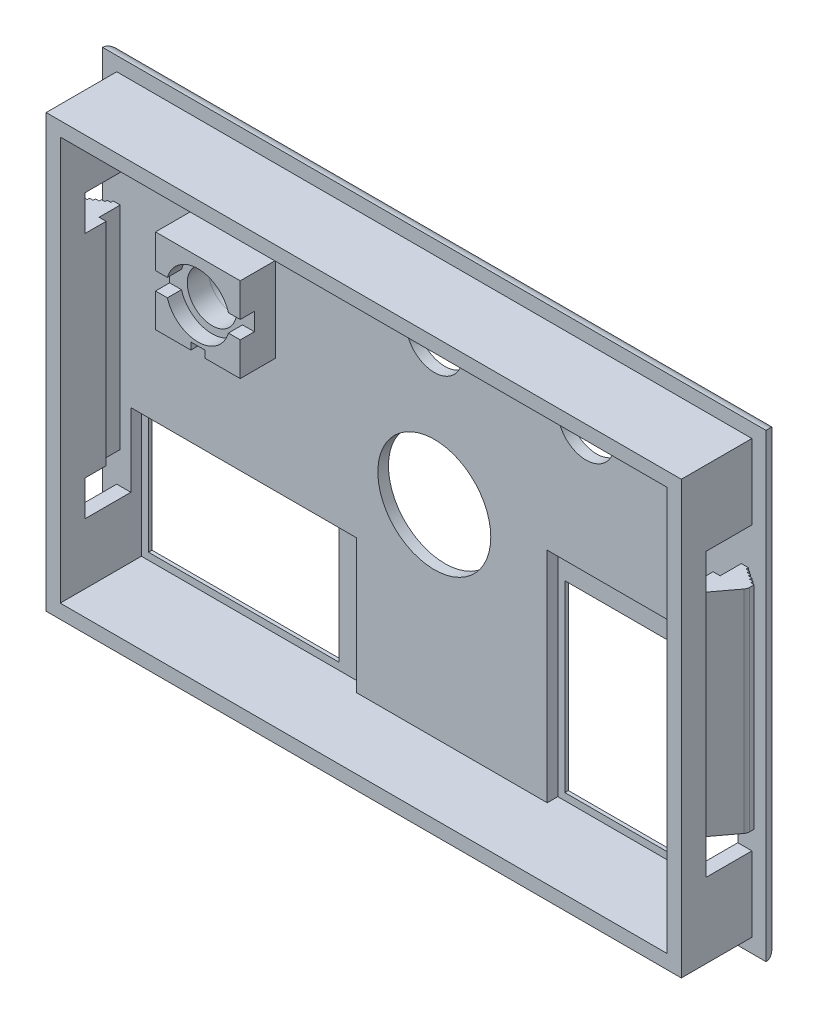
from build123d import *

# Parameters (mm, degrees)
SKETCH_1_W             = 94
SKETCH_1_H             = 65.2
EXTRUDE_1_DEPTH        = 2
SKETCH_2_R             = 8
SKETCH_2_R_2           = 3.5
SKETCH_2_R_3           = 4
SKETCH_2_W             = 27
SKETCH_2_H             = 17
SKETCH_2_W_2           = 25
SKETCH_2_H_2           = 26
CUT_EXTRUDE_1_DEPTH    = 2
SKETCH_3_W             = 90
SKETCH_3_H             = 61.2
SKETCH_3_W_2           = 86
SKETCH_3_H_2           = 57.2
EXTRUDE_2_DEPTH        = 10
SKETCH_4_R             = 9
SKETCH_4_R_2           = 5
CUT_EXTRUDE_4_DEPTH    = 0.5
SKETCH_5_W             = 27
SKETCH_5_H             = 31
SKETCH_5_W_2           = 32
SKETCH_5_H_2           = 19
CUT_EXTRUDE_5_DEPTH    = 1.5
SKETCH_6_W             = 12
SKETCH_6_H             = 12
SKETCH_6_R             = 3.5
EXTRUDE_4_DEPTH        = 5
SKETCH_7_W             = 2
SKETCH_7_H             = 1
CUT_EXTRUDE_6_DEPTH    = 3
CUT_EXTRUDE_7_DEPTH    = 2
SKETCH_10_W            = 6
SKETCH_10_H            = 30
EXTRUDE_5_DEPTH        = 3
CUT_EXTRUDE_9_DEPTH    = 30
CUT_EXTRUDE_10_DEPTH   = 30
CUT_EXTRUDE_11_DEPTH   = 30
FILLET_1_R             = 1
FILLET_2_R             = 2
FILLET_1_OF_MIRROR_9_R = 1
SKETCH_17_R            = 4.5
CUT_EXTRUDE_13_DEPTH   = 2
SKETCH_18_W            = 1.677095884
SKETCH_18_H            = 2.5
CUT_EXTRUDE_14_DEPTH   = 2
SKETCH_19_W            = 1
SKETCH_19_H            = 3
CUT_EXTRUDE_15_DEPTH   = 30


with BuildPart() as part:
    # 草图1 → 凸台-拉伸1 (new body)
    with BuildSketch(Plane.XY):
        Rectangle(SKETCH_1_W, SKETCH_1_H)
    extrude(amount=EXTRUDE_1_DEPTH)

    # 草图2 → 切除-拉伸1 (cut)
    with BuildSketch(Plane.XY.offset(2)):
        Circle(SKETCH_2_R)
        with Locations((-28.5, 12.7)):
            Circle(SKETCH_2_R_2)
        with Locations((37.5, 20.2)):
            Circle(SKETCH_2_R_3)
        with Locations((21.5, 20.2)):
            Circle(SKETCH_2_R_3)
        with Locations((0, 20.2)):
            Circle(SKETCH_2_R_3)
        with Locations((-28.5, -19.1)):
            Rectangle(SKETCH_2_W, SKETCH_2_H)
        with Locations((29.5, -14.6)):
            Rectangle(SKETCH_2_W_2, SKETCH_2_H_2)
    extrude(amount=-CUT_EXTRUDE_1_DEPTH, mode=Mode.SUBTRACT)

    # 草图3 → 凸台-拉伸2 (add)
    with BuildSketch(Plane.XY.offset(2)):
        Rectangle(SKETCH_3_W, SKETCH_3_H)
        Rectangle(SKETCH_3_W_2, SKETCH_3_H_2, mode=Mode.SUBTRACT)
    extrude(amount=EXTRUDE_2_DEPTH)

    # 草图4 → 切除-拉伸4 (cut)
    with BuildSketch(Plane(origin=(0, 0, 0), x_dir=(-1, 0, 0), z_dir=(0, 0, -1))):
        Circle(SKETCH_4_R)
        with Locations((0, 20.2)):
            Circle(SKETCH_4_R_2)
        with Locations((-21.5, 20.2)):
            Circle(SKETCH_4_R_2)
        with Locations((-37.5, 20.2)):
            Circle(SKETCH_4_R_2)
    extrude(amount=-CUT_EXTRUDE_4_DEPTH, mode=Mode.SUBTRACT)

    # 草图5 → 切除-拉伸5 (cut)
    with BuildSketch(Plane.XY.offset(2)):
        with Locations((29.5, -13.1)):
            Rectangle(SKETCH_5_W, SKETCH_5_H)
        with Locations((-27, -19.1)):
            Rectangle(SKETCH_5_W_2, SKETCH_5_H_2)
    extrude(amount=-CUT_EXTRUDE_5_DEPTH, mode=Mode.SUBTRACT)

    # 草图9 → 切除-拉伸7 (cut)
    with BuildSketch(Plane(origin=(45, 0, 0), x_dir=(0, 0, -1), z_dir=(1, 0, 0))):
        Polygon((-8.5, 20), (-8.5, 15), (-2.5, 15), (-2.5, -15), (-8.5, -15), (-8.5, -20), (-4.518745162, -20), (-2, -20), (-2, 20), align=None)
    cut_extrude_7 = extrude(amount=-CUT_EXTRUDE_7_DEPTH, mode=Mode.SUBTRACT)

    # 草图10 → 凸台-拉伸5 (add)
    with BuildSketch(Plane(origin=(45, 0, 0), x_dir=(0, 0, -1), z_dir=(1, 0, 0))):
        with Locations((-5.5, 0)):
            Rectangle(SKETCH_10_W, SKETCH_10_H)
    extrude_5 = extrude(amount=EXTRUDE_5_DEPTH)

    # 草图13 → 切除-拉伸9 (cut)
    with BuildSketch(Plane(origin=(0, 15, 0), x_dir=(1, 0, 0), z_dir=(0, 1, 0))):
        Polygon((48, -4.5), (48, -2.5), (45, -2.5), (45, -2.837675063), (45.5, -2.837675063), (45.5, -3.168378765), (46, -3.168378765), (46, -3.502957406), (46.5, -3.502957406), (46.5, -3.840024676), (47, -3.840024676), (47, -4.169256843), (47.5, -4.169256843), (47.5, -4.5), align=None)
    cut_extrude_9 = extrude(amount=-CUT_EXTRUDE_9_DEPTH, mode=Mode.SUBTRACT)

    # 草图14 → 切除-拉伸10 (cut)
    with BuildSketch(Plane(origin=(0, 15, 0), x_dir=(1, 0, 0), z_dir=(0, 1, 0))):
        Polygon((45, -8.5), (48, -4.5), (48, -8.5), align=None)
    cut_extrude_10 = extrude(amount=-CUT_EXTRUDE_10_DEPTH, mode=Mode.SUBTRACT)

    # 草图15 → 切除-拉伸11 (cut)
    with BuildSketch(Plane(origin=(0, 15, 0), x_dir=(1, 0, 0), z_dir=(0, 1, 0))):
        Polygon((47.5, -4.5), (47.5, -5.166666667), (48, -4.5), align=None)
    cut_extrude_11 = extrude(amount=-CUT_EXTRUDE_11_DEPTH, mode=Mode.SUBTRACT)

    # 圆角1
    fillet_1_edges = [part.edges().sort_by_distance(p)[0] for p in [
        (47.5, 0, 5.166666667),
    ]]
    fillet(fillet_1_edges, radius=FILLET_1_R)

    # 圆角2
    fillet_2_edges = [part.edges().sort_by_distance(p)[0] for p in [
        (47, 0, 0),
        (0, -32.6, 0),
        (-47, 0, 0),
        (0, 32.6, 0),
    ]]
    fillet(fillet_2_edges, radius=FILLET_2_R - 0.0001)  # a hair under: the kernel refuses the full size

    # 镜向9: 切除-拉伸7, 凸台-拉伸5, 切除-拉伸9, 切除-拉伸10, 切除-拉伸11 across plane
    add(cut_extrude_7.mirror(Plane(origin=(0, 0, 0), x_dir=(0, 0, 1), z_dir=(1, 0, 0))), mode=Mode.SUBTRACT)
    add(extrude_5.mirror(Plane(origin=(0, 0, 0), x_dir=(0, 0, 1), z_dir=(1, 0, 0))))
    add(cut_extrude_9.mirror(Plane(origin=(0, 0, 0), x_dir=(0, 0, 1), z_dir=(1, 0, 0))), mode=Mode.SUBTRACT)
    add(cut_extrude_10.mirror(Plane(origin=(0, 0, 0), x_dir=(0, 0, 1), z_dir=(1, 0, 0))), mode=Mode.SUBTRACT)
    add(cut_extrude_11.mirror(Plane(origin=(0, 0, 0), x_dir=(0, 0, 1), z_dir=(1, 0, 0))), mode=Mode.SUBTRACT)

    # 圆角1 of 镜向9
    fillet_1_of_mirror_9_edges = [part.edges().sort_by_distance(p)[0] for p in [
        (-47.5, 0, 5.166666667),
    ]]
    fillet(fillet_1_of_mirror_9_edges, radius=FILLET_1_OF_MIRROR_9_R)

    # 草图19 → 切除-拉伸15 (cut)
    with BuildSketch(Plane(origin=(0, 15, 0), x_dir=(1, 0, 0), z_dir=(0, 1, 0))):
        with Locations((43.5, -4)):
            Rectangle(SKETCH_19_W, SKETCH_19_H)
    cut_extrude_15 = extrude(amount=-CUT_EXTRUDE_15_DEPTH, mode=Mode.SUBTRACT)

    # 镜向11: 切除-拉伸15 across plane
    add(cut_extrude_15.mirror(Plane(origin=(0, 0, 0), x_dir=(0, 0, 1), z_dir=(1, 0, 0))), mode=Mode.SUBTRACT)


with BuildPart() as body_2:
    # 草图6 → 凸台-拉伸4 (new body)
    with BuildSketch(Plane.XY.offset(2)):
        with Locations((-28.5, 12.7)):
            Rectangle(SKETCH_6_W, SKETCH_6_H)
        with Locations((-28.5, 12.7)):
            Circle(SKETCH_6_R, mode=Mode.SUBTRACT)
    extrude(amount=EXTRUDE_4_DEPTH)

    # 草图7 → 切除-拉伸6 (cut)
    with BuildSketch(Plane.XY.offset(7)):
        with Locations((-28.5, 7.2)):
            Rectangle(SKETCH_7_W, SKETCH_7_H)
    extrude(amount=-CUT_EXTRUDE_6_DEPTH, mode=Mode.SUBTRACT)

    # 草图17 → 切除-拉伸13 (cut)
    with BuildSketch(Plane.XY.offset(7)):
        with Locations((-28.5, 12.7)):
            Circle(SKETCH_17_R)
    extrude(amount=-CUT_EXTRUDE_13_DEPTH, mode=Mode.SUBTRACT)

    # 草图18 → 切除-拉伸14 (cut)
    with BuildSketch(Plane.XY.offset(7)):
        with Locations((-33.661452058, 12.7)):
            Rectangle(SKETCH_18_W, SKETCH_18_H)
    cut_extrude_14 = extrude(amount=-CUT_EXTRUDE_14_DEPTH, mode=Mode.SUBTRACT)

    # 镜向10: 切除-拉伸14 across plane
    add(cut_extrude_14.mirror(Plane(origin=(-28.5, 0, 0), x_dir=(0, 0, 1), z_dir=(1, 0, 0))), mode=Mode.SUBTRACT)


solid = Compound([part.part, body_2.part])
